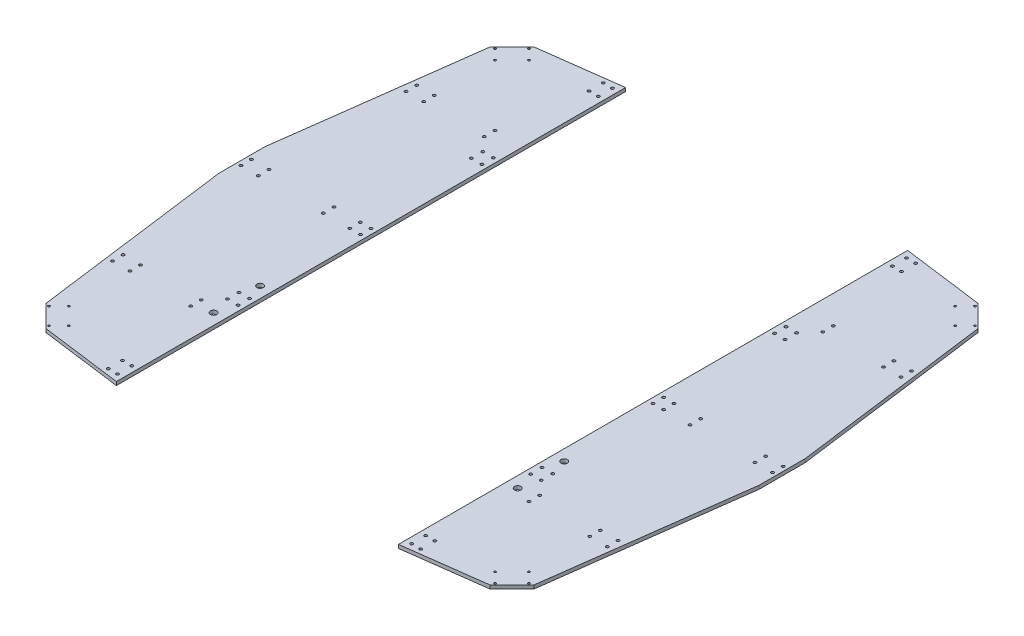
from build123d import *

# Parameters (mm, degrees)
SKETCH_1_R               = 1.5
SKETCH_1_R_2             = 1.999999999
SKETCH_1_R_3             = 2
SKETCH_1_R_4             = 4.5
SKETCH_1_R_5             = 2.000000001
SKETCH_1_R_6             = 2.000000002
SKETCH_1_R_7             = 2.000000003
SKETCH_1_R_8             = 250
SKETCH_1_R_9             = 1.999999988
EXTRUDE_2_DEPTH          = 5
CUT_EXTRUDE_1_DEPTH      = 542.772616539
CUT_EXTRUDE_1_DEPTH_BACK = 122
CUT_EXTRUDE_2_DEPTH      = 527.431195247
CUT_EXTRUDE_2_DEPTH_BACK = 39
SKETCH_3_R               = 2
CUT_EXTRUDE_3_DEPTH      = 20
CUT_EXTRUDE_3_DEPTH_BACK = 527.431195247
SKETCH_4_R               = 2
SKETCH_5_R               = 2.000000001
SKETCH_5_R_2             = 1.999999999
EXTRUDE_3_DEPTH          = 5
SKETCH_6_R               = 2
SKETCH_6_R_2             = 2.000000001
CUT_EXTRUDE_5_DEPTH      = 33


with BuildPart() as part:
    # 草图1 → 凸台-拉伸2 (new body)
    with BuildSketch(Plane(origin=(0, 0, 0), x_dir=(1, 0, 0), z_dir=(0, 1, 0))):
        Polygon((-32.720120418, 383.074776011), (-314.922171201, 345.922171201), (-345.922171201, 314.922171201), (-383.074776011, 32.720120418), (-383.074776011, -32.720120418), (-345.922171201, -314.922171201), (-314.922171201, -345.922171201), (-32.720120418, -383.074776011), (32.720120418, -383.074776011), (314.922171201, -345.922171201), (345.922171201, -314.922171201), (383.074776011, -32.720120418), (383.074776011, 32.720120418), (345.922171201, 314.922171201), (314.922171201, 345.922171201), (32.720120418, 383.074776011), (0, 383.074776011), align=None)
        with Locations((-316.280035574, -340.321666135)):
            Circle(SKETCH_1_R, mode=Mode.SUBTRACT)
        with Locations((-340.321666134, -316.280035574)):
            Circle(SKETCH_1_R, mode=Mode.SUBTRACT)
        with Locations((-302.137899951, -326.179530511)):
            Circle(SKETCH_1_R, mode=Mode.SUBTRACT)
        with Locations((-326.179530511, -302.137899951)):
            Circle(SKETCH_1_R, mode=Mode.SUBTRACT)
        with Locations((-350.918362049, -215.681953419)):
            Circle(SKETCH_1_R_2, mode=Mode.SUBTRACT)
        with Locations((-350.918362049, -200.681953419)):
            Circle(SKETCH_1_R_2, mode=Mode.SUBTRACT)
        with Locations((-325.918362049, -215.681953419)):
            Circle(SKETCH_1_R_2, mode=Mode.SUBTRACT)
        with Locations((-325.918362049, -200.681953419)):
            Circle(SKETCH_1_R_2, mode=Mode.SUBTRACT)
        with Locations((-240, -215.681953429)):
            Circle(SKETCH_1_R_3, mode=Mode.SUBTRACT)
        with Locations((-240, -200.681953429)):
            Circle(SKETCH_1_R_3, mode=Mode.SUBTRACT)
        with Locations((-215.612697258, -207.55428794)):
            Circle(SKETCH_1_R_4, mode=Mode.SUBTRACT)
        with Locations((-222.5, -181.030079822)):
            Circle(SKETCH_1_R_3, mode=Mode.SUBTRACT)
        with Locations((-207.5, -181.030079822)):
            Circle(SKETCH_1_R_3, mode=Mode.SUBTRACT)
        with Locations((-222.500000001, -164.825516547)):
            Circle(SKETCH_1_R_5, mode=Mode.SUBTRACT)
        with Locations((-207.500000001, -164.825516547)):
            Circle(SKETCH_1_R_5, mode=Mode.SUBTRACT)
        with Locations((-215.612697258, -141.55428794)):
            Circle(SKETCH_1_R_4, mode=Mode.SUBTRACT)
        with Locations((-377.074776011, -7.499878938)):
            Circle(SKETCH_1_R_3, mode=Mode.SUBTRACT)
        with Locations((-352.074776011, -7.499878938)):
            Circle(SKETCH_1_R_3, mode=Mode.SUBTRACT)
        with Locations((-260, -7.5)):
            Circle(SKETCH_1_R_3, mode=Mode.SUBTRACT)
        with Locations((316.280035574, -340.321666135)):
            Circle(SKETCH_1_R, mode=Mode.SUBTRACT)
        with Locations((302.13789995, -326.179530511)):
            Circle(SKETCH_1_R, mode=Mode.SUBTRACT)
        with Locations((326.179530511, -302.137899951)):
            Circle(SKETCH_1_R, mode=Mode.SUBTRACT)
        with Locations((340.321666135, -316.280035574)):
            Circle(SKETCH_1_R, mode=Mode.SUBTRACT)
        with Locations((215.612697258, -207.55428794)):
            Circle(SKETCH_1_R_4, mode=Mode.SUBTRACT)
        with Locations((240, -215.681953429)):
            Circle(SKETCH_1_R_3, mode=Mode.SUBTRACT)
        with Locations((240, -200.681953429)):
            Circle(SKETCH_1_R_3, mode=Mode.SUBTRACT)
        with Locations((325.918362038, -215.681953499)):
            Circle(SKETCH_1_R_6, mode=Mode.SUBTRACT)
        with Locations((325.918362038, -200.681953499)):
            Circle(SKETCH_1_R_6, mode=Mode.SUBTRACT)
        with Locations((350.918362038, -215.681953499)):
            Circle(SKETCH_1_R_6, mode=Mode.SUBTRACT)
        with Locations((350.918362038, -200.681953499)):
            Circle(SKETCH_1_R_6, mode=Mode.SUBTRACT)
        with Locations((207.5, -181.030079822)):
            Circle(SKETCH_1_R_3, mode=Mode.SUBTRACT)
        with Locations((222.5, -181.030079822)):
            Circle(SKETCH_1_R_3, mode=Mode.SUBTRACT)
        with Locations((207.500000001, -164.825516547)):
            Circle(SKETCH_1_R_5, mode=Mode.SUBTRACT)
        with Locations((222.500000001, -164.825516547)):
            Circle(SKETCH_1_R_5, mode=Mode.SUBTRACT)
        with Locations((215.612697258, -141.55428794)):
            Circle(SKETCH_1_R_4, mode=Mode.SUBTRACT)
        with Locations((260, -7.5)):
            Circle(SKETCH_1_R_3, mode=Mode.SUBTRACT)
        with Locations((352.074776011, -7.595099646)):
            Circle(SKETCH_1_R_3, mode=Mode.SUBTRACT)
        with Locations((377.074776011, -7.595099646)):
            Circle(SKETCH_1_R_3, mode=Mode.SUBTRACT)
        with Locations((-377.074776011, 7.500121062)):
            Circle(SKETCH_1_R_3, mode=Mode.SUBTRACT)
        with Locations((-352.074776011, 7.500121062)):
            Circle(SKETCH_1_R_3, mode=Mode.SUBTRACT)
        with Locations((-260, 7.5)):
            Circle(SKETCH_1_R_3, mode=Mode.SUBTRACT)
        with Locations((-222.500000001, 164.825516547)):
            Circle(SKETCH_1_R_5, mode=Mode.SUBTRACT)
        with Locations((-207.500000001, 164.825516547)):
            Circle(SKETCH_1_R_5, mode=Mode.SUBTRACT)
        with Locations((-222.5, 181.030079822)):
            Circle(SKETCH_1_R_3, mode=Mode.SUBTRACT)
        with Locations((-207.5, 181.030079822)):
            Circle(SKETCH_1_R_3, mode=Mode.SUBTRACT)
        with Locations((-350.918362049, 200.681953419)):
            Circle(SKETCH_1_R_7, mode=Mode.SUBTRACT)
        with Locations((-350.918362049, 215.681953419)):
            Circle(SKETCH_1_R_7, mode=Mode.SUBTRACT)
        with Locations((-325.918362049, 200.681953419)):
            Circle(SKETCH_1_R_7, mode=Mode.SUBTRACT)
        with Locations((-325.918362049, 215.681953419)):
            Circle(SKETCH_1_R_7, mode=Mode.SUBTRACT)
        with Locations((-240, 200.681953428)):
            Circle(SKETCH_1_R_3, mode=Mode.SUBTRACT)
        with Locations((-240, 215.681953428)):
            Circle(SKETCH_1_R_3, mode=Mode.SUBTRACT)
        with Locations((-340.321666134, 316.280035574)):
            Circle(SKETCH_1_R, mode=Mode.SUBTRACT)
        with Locations((-326.179530511, 302.137899951)):
            Circle(SKETCH_1_R, mode=Mode.SUBTRACT)
        with Locations((-302.13789995, 326.179530511)):
            Circle(SKETCH_1_R, mode=Mode.SUBTRACT)
        with Locations((-316.280035574, 340.321666134)):
            Circle(SKETCH_1_R, mode=Mode.SUBTRACT)
        Circle(SKETCH_1_R_8, mode=Mode.SUBTRACT)
        with Locations((260, 7.5)):
            Circle(SKETCH_1_R_3, mode=Mode.SUBTRACT)
        with Locations((352.074776011, 7.500121062)):
            Circle(SKETCH_1_R_3, mode=Mode.SUBTRACT)
        with Locations((377.074776011, 7.500121062)):
            Circle(SKETCH_1_R_3, mode=Mode.SUBTRACT)
        with Locations((207.500000001, 164.825516547)):
            Circle(SKETCH_1_R_2, mode=Mode.SUBTRACT)
        with Locations((222.500000001, 164.825516547)):
            Circle(SKETCH_1_R_2, mode=Mode.SUBTRACT)
        with Locations((207.5, 181.030079822)):
            Circle(SKETCH_1_R_3, mode=Mode.SUBTRACT)
        with Locations((222.5, 181.030079822)):
            Circle(SKETCH_1_R_3, mode=Mode.SUBTRACT)
        with Locations((240, 200.681953428)):
            Circle(SKETCH_1_R_3, mode=Mode.SUBTRACT)
        with Locations((240, 215.681953428)):
            Circle(SKETCH_1_R_3, mode=Mode.SUBTRACT)
        with Locations((325.918362038, 200.681953498)):
            Circle(SKETCH_1_R_9, mode=Mode.SUBTRACT)
        with Locations((325.918362038, 215.681953498)):
            Circle(SKETCH_1_R_9, mode=Mode.SUBTRACT)
        with Locations((350.918362038, 200.681953498)):
            Circle(SKETCH_1_R_9, mode=Mode.SUBTRACT)
        with Locations((350.918362038, 215.681953498)):
            Circle(SKETCH_1_R_9, mode=Mode.SUBTRACT)
        with Locations((326.179530511, 302.13789995)):
            Circle(SKETCH_1_R, mode=Mode.SUBTRACT)
        with Locations((302.137899951, 326.179530511)):
            Circle(SKETCH_1_R, mode=Mode.SUBTRACT)
        with Locations((340.321666135, 316.280035574)):
            Circle(SKETCH_1_R, mode=Mode.SUBTRACT)
        with Locations((316.280035574, 340.321666134)):
            Circle(SKETCH_1_R, mode=Mode.SUBTRACT)
    extrude(amount=EXTRUDE_2_DEPTH)

    # 草图2 → 切除-拉伸1 (cut, two sides: drawn at the far end of the back side and taken through both)
    with BuildSketch(Plane(origin=(0, 5, 0), x_dir=(1, 0, 0), z_dir=(0, 1, 0)).offset(-CUT_EXTRUDE_1_DEPTH_BACK)):
        Polygon((-200, 484.714921051), (-200, 361.051962068), (-200, -361.051962068), (-200, -418.819036359), (200, -418.819036359), (200, -361.051962068), (200, 361.051962068), (200, 484.714921051), align=None)
    extrude(amount=CUT_EXTRUDE_1_DEPTH + CUT_EXTRUDE_1_DEPTH_BACK, mode=Mode.SUBTRACT)


with BuildPart() as cut_extrude_1_piece_1:
    # of the separate pieces the step leaves, piece 1, a body of its own (cut_extrude_1_pieces)
    add(part.part.solids().sort_by_distance((200, 0, 361.051962068))[0])

    # 草图4 → 切除-拉伸3 (cut, two sides: drawn at the far end of the back side and taken through both)
    with BuildSketch(Plane(origin=(0, 5, 0), x_dir=(1, 0, 0), z_dir=(0, 1, 0)).offset(-CUT_EXTRUDE_3_DEPTH_BACK)):
        with Locations((-221.500000001, -330.922325919)):
            Circle(SKETCH_4_R)
        with Locations((-208.500000001, -330.922325919)):
            Circle(SKETCH_4_R)
        with Locations((-208.500000001, -350.922325919)):
            Circle(SKETCH_4_R)
        with Locations((-221.500000001, -350.922325919)):
            Circle(SKETCH_4_R)
        with Locations((221.500000002, -350.922325919)):
            Circle(SKETCH_4_R)
        with Locations((208.500000002, -350.922325919)):
            Circle(SKETCH_4_R)
        with Locations((208.500000002, -330.922325919)):
            Circle(SKETCH_4_R)
        with Locations((221.500000002, -330.922325919)):
            Circle(SKETCH_4_R)
    extrude(amount=CUT_EXTRUDE_3_DEPTH + CUT_EXTRUDE_3_DEPTH_BACK, mode=Mode.SUBTRACT)



with BuildPart() as cut_extrude_1_piece_2:
    # of the separate pieces the step leaves, piece 2, a body of its own (cut_extrude_1_pieces)
    add(part.part.solids().sort_by_distance((-314.922171201, 0, 345.922171201))[0])

    # 草图3 → 切除-拉伸2 (cut, two sides: drawn at the far end of the back side and taken through both)
    with BuildSketch(Plane(origin=(0, 0, 0), x_dir=(-1, 0, 0), z_dir=(0, -1, 0)).offset(-CUT_EXTRUDE_2_DEPTH_BACK)):
        with Locations((208.500000001, -330.922325919)):
            Circle(SKETCH_3_R)
        with Locations((221.500000001, -330.922325919)):
            Circle(SKETCH_3_R)
        with Locations((221.500000001, -350.922325919)):
            Circle(SKETCH_3_R)
        with Locations((208.500000001, -350.922325919)):
            Circle(SKETCH_3_R)
    extrude(amount=CUT_EXTRUDE_2_DEPTH + CUT_EXTRUDE_2_DEPTH_BACK, mode=Mode.SUBTRACT)


with BuildPart() as cut_extrude_1_piece_1_1:
    add(cut_extrude_1_piece_1.part)

    add(cut_extrude_1_piece_2.part)  # 凸台-拉伸3 merges 切除-拉伸1 piece 2
    # 草图5 → 凸台-拉伸3 (add)
    # profile 1 of 2: a face of its own
    with BuildSketch(Plane(origin=(0, 5, 0), x_dir=(1, 0, 0), z_dir=(0, 1, 0))):
        with BuildLine():
            Line((-200, 7.5), (-200, 150))
            ThreePointArc((-200, 150), (-250, 0), (-200, -150))
            Line((-200, -150), (-200, -7.5))
            Line((-200.000000001, -7.5), (-200.000000001, 7.5))
        make_face()
        with Locations((-222.500000001, -7.5)):
            Circle(SKETCH_5_R, mode=Mode.SUBTRACT)
        with Locations((-207.500000001, -7.5)):
            Circle(SKETCH_5_R, mode=Mode.SUBTRACT)
        with Locations((-222.500000001, 7.5)):
            Circle(SKETCH_5_R, mode=Mode.SUBTRACT)
        with Locations((-207.500000001, 7.5)):
            Circle(SKETCH_5_R, mode=Mode.SUBTRACT)
    # profile 2 of 2: a face of its own
    with BuildSketch(Plane(origin=(0, 5, 0), x_dir=(1, 0, 0), z_dir=(0, 1, 0))):
        with BuildLine():
            ThreePointArc((200, -150), (250, 0), (200, 150))
            Line((200, 150), (200, -150))
        make_face()
        with Locations((207.500000001, -7.5)):
            Circle(SKETCH_5_R_2, mode=Mode.SUBTRACT)
        with Locations((222.500000001, -7.5)):
            Circle(SKETCH_5_R_2, mode=Mode.SUBTRACT)
        with Locations((207.500000001, 7.5)):
            Circle(SKETCH_5_R_2, mode=Mode.SUBTRACT)
        with Locations((222.500000001, 7.5)):
            Circle(SKETCH_5_R_2, mode=Mode.SUBTRACT)
    extrude(amount=-EXTRUDE_3_DEPTH)

    # 草图6 → 切除-拉伸5 (cut)
    with BuildSketch(Plane(origin=(0, 5, 0), x_dir=(1, 0, 0), z_dir=(0, 1, 0))):
        with Locations((-208.500000001, 350.918401784)):
            Circle(SKETCH_6_R)
        with Locations((-221.500000001, 350.918401784)):
            Circle(SKETCH_6_R)
        with Locations((-221.500000001, 330.918401784)):
            Circle(SKETCH_6_R)
        with Locations((-208.500000001, 330.918401784)):
            Circle(SKETCH_6_R)
        with Locations((221.499999992, 350.918401782)):
            Circle(SKETCH_6_R_2)
        with Locations((208.499999992, 350.918401782)):
            Circle(SKETCH_6_R_2)
        with Locations((208.499999992, 330.918401782)):
            Circle(SKETCH_6_R_2)
        with Locations((221.499999992, 330.918401782)):
            Circle(SKETCH_6_R_2)
    extrude(amount=-CUT_EXTRUDE_5_DEPTH, mode=Mode.SUBTRACT)


solid = cut_extrude_1_piece_1_1.part
